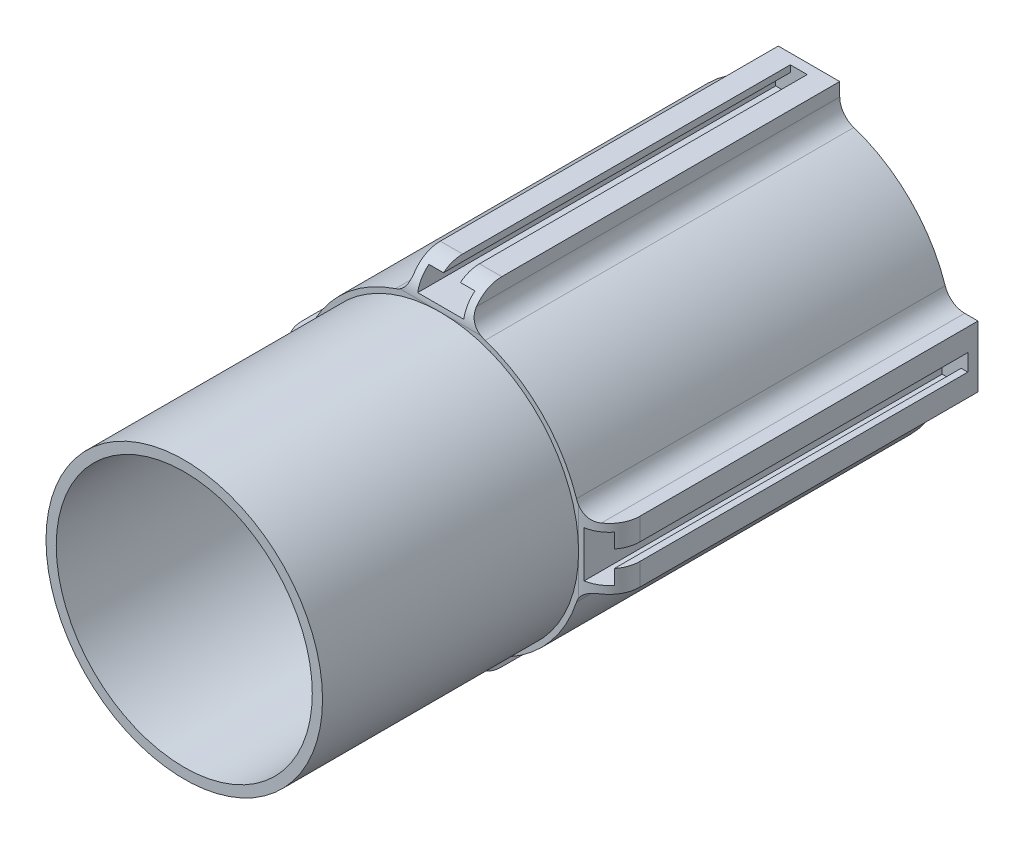
from build123d import *

# Parameters (mm, degrees)
CROQUIS1_R                 = 14
SALIENTE_EXTRUIR1_DEPTH    = 36
CROQUIS2_R                 = 6.55
CORTAR_EXTRUIR1_DEPTH      = 33
CROQUIS3_R                 = 4.5
CORTAR_EXTRUIR2_DEPTH      = 1
VACIADO3_START             = -36
VACIADO3_OUTLINE_R         = 14
VACIADO3_OUTLINE_R_2       = 7.55
VACIADO3_DEPTH             = 36
VACIADO3_2_OUTLINE_R       = 7.55
VACIADO3_2_DEPTH           = 1
VACIADO3_START_2           = -35
VACIADO3_3_OUTLINE_R       = 7.55
VACIADO3_3_OUTLINE_R_2     = 5.5
VACIADO3_3_DEPTH           = 1
CROQUIS4_R                 = 14
CROQUIS4_R_2               = 13
EXTRUIR_L_MINA1_DEPTH      = 36
CROQUIS11_R                = 13
SALIENTE_EXTRUIR2_DEPTH    = 2
CORTAR_EXTRUIR8_REACH      = 41.345
CROQUIS20_R                = 4.5
SALIENTE_EXTRUIR6_START    = -0.325206
SALIENTE_EXTRUIR6_DEPTH    = 2.825206
CORTAR_EXTRUIR9_DEPTH      = 35
CROQUIS31_R                = 13
CROQUIS31_R_2              = 7
EXTRUIR_L_MINA2_DEPTH      = 0.5
CROQUIS33_R                = 13.5
CROQUIS33_R_2              = 12.5
EXTRUIR_L_MINA3_DEPTH      = 25
REDONDEO2_R                = 2
REDONDEO6_R                = 3
MATRIZC1_COUNT             = 4
REDONDEO2_OF_MATRIZC1_R    = 2
REDONDEO6_OF_MATRIZC1_R    = 3
CHAFL_N2_SIZE              = 2.300736814
CHAFL_N2_SIZE2             = 2
CHAFL_N4_SIZE              = 6
S_LIDO_MOVER_COPIAR2_ANGLE = 180
CROQUIS35_R                = 2.5
CORTAR_EXTRUIR11_DEPTH     = 0.585651992
MATRIZC2_COUNT             = 10
CROQUIS38_R                = 6.75
CROQUIS38_R_2              = 6.5
EXTRUIR_L_MINA4_DEPTH      = 15


# Read off the part's stored shape, not the designer's step: Vaciado3
# Some blends are built 0.0001 mm under size
with BuildPart() as part:
    # Croquis1 → Saliente-Extruir1 (new body)
    with BuildSketch(Plane.XY):
        Circle(CROQUIS1_R)
    extrude(amount=-SALIENTE_EXTRUIR1_DEPTH)

    # Croquis2 → Cortar-Extruir1 (cut)
    with BuildSketch(Plane.XY):
        Circle(CROQUIS2_R)
    extrude(amount=-CORTAR_EXTRUIR1_DEPTH, mode=Mode.SUBTRACT)

    # Croquis3 → Cortar-Extruir2 (cut)
    with BuildSketch(Plane.XY.offset(-33)):
        Circle(CROQUIS3_R)
    extrude(amount=-CORTAR_EXTRUIR2_DEPTH, mode=Mode.SUBTRACT)

    # Vaciado3 outline → Vaciado3 (cut)
    with BuildSketch(Plane.XY.offset(VACIADO3_START)):
        Circle(VACIADO3_OUTLINE_R)
        Circle(VACIADO3_OUTLINE_R_2, mode=Mode.SUBTRACT)
    extrude(amount=VACIADO3_DEPTH, mode=Mode.SUBTRACT)

    # Vaciado3 2 outline → Vaciado3 2 (cut)
    with BuildSketch(Plane.XY.offset(VACIADO3_START)):
        Circle(VACIADO3_2_OUTLINE_R)
    extrude(amount=VACIADO3_2_DEPTH, mode=Mode.SUBTRACT)

    # Vaciado3 3 outline → Vaciado3 3 (cut)
    with BuildSketch(Plane.XY.offset(VACIADO3_START_2)):
        Circle(VACIADO3_3_OUTLINE_R)
        Circle(VACIADO3_3_OUTLINE_R_2, mode=Mode.SUBTRACT)
    extrude(amount=VACIADO3_3_DEPTH, mode=Mode.SUBTRACT)



with BuildPart() as body_2:
    # Croquis4 → Extruir-Lámina1 (new body)
    with BuildSketch(Plane.XY):
        Circle(CROQUIS4_R)
        Circle(CROQUIS4_R_2, mode=Mode.SUBTRACT)
    extrude(amount=-EXTRUIR_L_MINA1_DEPTH)


with BuildPart() as part_1:
    add(part.part)

    add(body_2.part)  # Saliente-Extruir2 merges body 2
    # Croquis11 → Saliente-Extruir2 (add)
    with BuildSketch(Plane.XY.offset(-34)):
        Circle(CROQUIS11_R)
    extrude(amount=-SALIENTE_EXTRUIR2_DEPTH)

    # Croquis20 → Cortar-Extruir8 (cut, up to next)
    with BuildSketch(Plane.XY.offset(-34), mode=Mode.PRIVATE) as cortar_extruir8_sk1:
        Circle(CROQUIS20_R)
    cortar_extruir8_tool1 = extrude(cortar_extruir8_sk1.sketch, amount=-CORTAR_EXTRUIR8_REACH, mode=Mode.PRIVATE) & part_1.part
    add(cortar_extruir8_tool1.solids().sort_by_distance((0, 0, -34))[0], mode=Mode.SUBTRACT)

    # Croquis21 → Saliente-Extruir6 (add)
    with BuildSketch(Plane(origin=(0, 14, 0), x_dir=(1, 0, 0), z_dir=(0, 1, 0)).offset(SALIENTE_EXTRUIR6_START)):
        Polygon((0, 0), (-3, 0), (-3, 36), (3, 36), (3, 0), align=None)
    saliente_extruir6 = extrude(amount=SALIENTE_EXTRUIR6_DEPTH)

    # Croquis29 → Cortar-Extruir9 (cut)
    with BuildSketch(Plane(origin=(0, 0, -36), x_dir=(-1, 0, 0), z_dir=(0, 0, -1))):
        Polygon((-2.25, 14), (2.25, 14), (2.25, 15.85), (0.825, 15.85), (0.825, 16.5), (-0.825, 16.5), (-0.825, 15.85), (-2.25, 15.85), align=None)
    cortar_extruir9 = extrude(amount=-CORTAR_EXTRUIR9_DEPTH, mode=Mode.SUBTRACT)

    # Croquis31 → Extruir-Lámina2 (add)
    with BuildSketch(Plane.XY):
        Circle(CROQUIS31_R)
        Circle(CROQUIS31_R_2, mode=Mode.SUBTRACT)
    extrude(amount=-EXTRUIR_L_MINA2_DEPTH)

    # Croquis33 → Extruir-Lámina3 (add)
    with BuildSketch(Plane(origin=(0, 0, -36), x_dir=(-1, 0, 0), z_dir=(0, 0, -1))):
        Circle(CROQUIS33_R)
        Circle(CROQUIS33_R_2, mode=Mode.SUBTRACT)
    extrude(amount=EXTRUIR_L_MINA3_DEPTH)

    # Redondeo2
    redondeo2_edges = [part_1.edges().sort_by_distance(p)[0] for p in [
        (-3, 13.674794, -18),
        (3, 13.674794, -18),
    ]]
    fillet(redondeo2_edges, radius=REDONDEO2_R)

    # Redondeo6
    # the kernel refuses this fillet: 3 mm, written as the material it takes off along each edge
    with BuildSketch(Plane(origin=(-10.5, 16.5, -36), x_dir=(0, 0, 1), z_dir=(1, 0, 0))) as redondeo6_piece_1:
        with BuildLine():
            CenterArc((REDONDEO6_R, REDONDEO6_R), REDONDEO6_R, 180, 90)
            Line((0, REDONDEO6_R), (0, 0))
            Line((0, 0), (REDONDEO6_R, 0))
        make_face()
    extrude(amount=17.175, mode=Mode.SUBTRACT)

    # MatrizC1: Saliente-Extruir6, Cortar-Extruir9 ×4 about axis
    matrizc1_axis = Axis((0, 0, 0), (0, 0, 1))
    add([saliente_extruir6.rotate(matrizc1_axis, i * 360 / MATRIZC1_COUNT) for i in range(1, MATRIZC1_COUNT)])
    add([cortar_extruir9.rotate(matrizc1_axis, i * 360 / MATRIZC1_COUNT) for i in range(1, MATRIZC1_COUNT)], mode=Mode.SUBTRACT)

    # Redondeo2 of MatrizC1
    redondeo2_of_matrizc1_edges = [part_1.edges().sort_by_distance(p)[0] for p in [
        (-13.674794, -3, -18),
        (-13.674794, 3, -18),
        (3, -13.674794, -18),
        (-3, -13.674794, -18),
        (13.674794, 3, -18),
        (13.674794, -3, -18),
    ]]
    fillet(redondeo2_of_matrizc1_edges, radius=REDONDEO2_OF_MATRIZC1_R)

    # Redondeo6 of MatrizC1
    # the kernel refuses this fillet: 3 mm, written as the material it takes off along each edge
    with BuildSketch(Plane(origin=(-16.5, -10.5, -36), x_dir=(0, 0, 1), z_dir=(0, 1, 0)), Plane(origin=(10.5, -16.5, -36), x_dir=(0, 0, 1), z_dir=(-1, 0, 0)), Plane(origin=(16.5, 10.5, -36), x_dir=(0, 0, 1), z_dir=(0, -1, 0))) as redondeo6_of_matrizc1_piece_1:
        with BuildLine():
            CenterArc((REDONDEO6_OF_MATRIZC1_R, REDONDEO6_OF_MATRIZC1_R), REDONDEO6_OF_MATRIZC1_R, 180, 90)
            Line((0, REDONDEO6_OF_MATRIZC1_R), (0, 0))
            Line((0, 0), (REDONDEO6_OF_MATRIZC1_R, 0))
        make_face()
    extrude(amount=17.175, mode=Mode.SUBTRACT)

    # Chaflán2
    chafl_n2_edges = [part_1.edges().sort_by_distance(p)[0] for p in [
        (-4.5, 0, -36),
    ]]
    chafl_n2_side = [part_1.faces().sort_by_distance(p)[0] for p in [
        (-4.5, 0, -34.5),
    ]]
    chamfer(chafl_n2_edges, length=CHAFL_N2_SIZE, length2=CHAFL_N2_SIZE2, reference=chafl_n2_side[0])

    # Chaflán4
    chafl_n4_edges = [part_1.edges().sort_by_distance(p)[0] for p in [
        (12.5, 0, -36),
    ]]
    chamfer(chafl_n4_edges, length=CHAFL_N4_SIZE - 0.0001)  # a hair under: the kernel refuses the full size


with BuildPart() as part_2:
    # Sólido-Mover/Copiar2: moved
    add(part_1.part.rotate(Axis((0, 0, 0), (0, 1, 0)), S_LIDO_MOVER_COPIAR2_ANGLE))

    # Croquis34 → Cortar-Revolución1 (revolve, cut)
    with BuildSketch(Plane(origin=(0, 0, 0), x_dir=(1, 0, 0), z_dir=(0, 1, 0))):
        Polygon((-12.5, -40.763390042), (-12.5, -34.585651992), (-6.995999587, -34.585651992), align=None)
    revolve(axis=Axis((0, 0, -36), (0, 0, 1)), mode=Mode.SUBTRACT)

    # Croquis35 → Cortar-Extruir11 (cut)
    with BuildSketch(Plane(origin=(0, 0, 34), x_dir=(-1, 0, 0), z_dir=(0, 0, -1))):
        with Locations((-10.25, 0)):
            Circle(CROQUIS35_R)
    cortar_extruir11 = extrude(amount=-CORTAR_EXTRUIR11_DEPTH, mode=Mode.SUBTRACT)

    # MatrizC2: Cortar-Extruir11 ×10 about axis
    matrizc2_axis = Axis((0, 0, 0), (0, 0, 1))
    for i in range(1, MATRIZC2_COUNT):
        add(cortar_extruir11.rotate(matrizc2_axis, i * 360 / MATRIZC2_COUNT), mode=Mode.SUBTRACT)

    # Croquis38 → Extruir-Lámina4 (add)
    with BuildSketch(Plane(origin=(0, 0, 0), x_dir=(-1, 0, 0), z_dir=(0, 0, -1))):
        Circle(CROQUIS38_R)
        Circle(CROQUIS38_R_2, mode=Mode.SUBTRACT)
    extrude(amount=-EXTRUIR_L_MINA4_DEPTH)


solid = part_2.part
